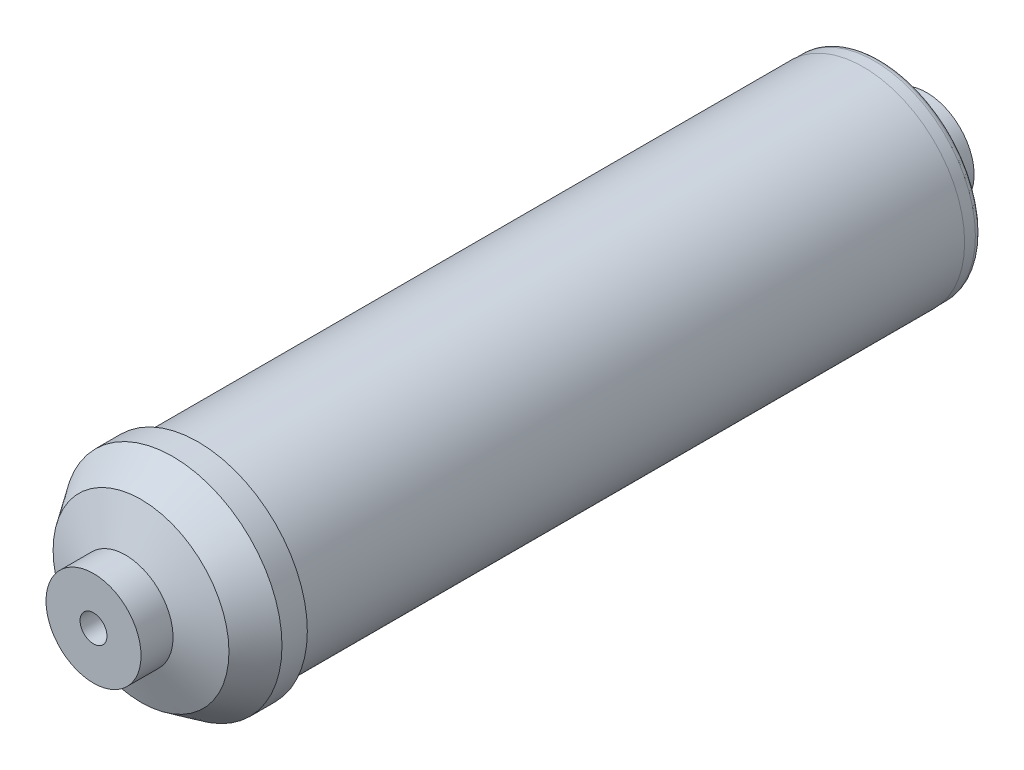
from build123d import *

# Parameters (mm, degrees)
SKETCH1_R           = 32
BOSS_EXTRUDE1_DEPTH = 210
SKETCH2_R           = 34.5
BOSS_EXTRUDE2_DEPTH = 18
CHAMFER1_SIZE       = 10
CHAMFER1_SIZE2      = 6.745085168
SKETCH3_R           = 27.754914832
BOSS_EXTRUDE3_DEPTH = 5
SKETCH4_R           = 15
BOSS_EXTRUDE4_DEPTH = 10
SKETCH5_R           = 4.25
CUT_EXTRUDE1_DEPTH  = 854
CHAMFER2_SIZE       = 5
CHAMFER2_SIZE_2     = 13.025445323
SKETCH7_R           = 31.9
BOSS_EXTRUDE7_DEPTH = 10
CHAMFER3_SIZE       = 5
CHAMFER3_SIZE2      = 17.437072219
FILLET1_R           = 2
BOSS_EXTRUDE8_START = 10
SKETCH8_R           = 15
BOSS_EXTRUDE8_DEPTH = 10
CUT_EXTRUDE2_START  = -311
SKETCH9_R           = 4.25
CUT_EXTRUDE2_DEPTH  = 311


with BuildPart() as part:
    # Sketch1 → Boss-Extrude1 (new body)
    with BuildSketch(Plane.XY):
        Circle(SKETCH1_R)
    extrude(amount=BOSS_EXTRUDE1_DEPTH)

    # Sketch2 → Boss-Extrude2 (add)
    with BuildSketch(Plane.XY.offset(210)):
        Circle(SKETCH2_R)
    extrude(amount=BOSS_EXTRUDE2_DEPTH)

    # Chamfer1
    chamfer1_edges = [part.edges().sort_by_distance(p)[0] for p in [
        (-34.5, 0, 228),
    ]]
    chamfer1_side = [part.faces().sort_by_distance(p)[0] for p in [
        (-34.5, 0, 219),
    ]]
    chamfer(chamfer1_edges, length=CHAMFER1_SIZE, length2=CHAMFER1_SIZE2, reference=chamfer1_side[0])

    # Sketch3 → Boss-Extrude3 (add)
    with BuildSketch(Plane.XY.offset(228)):
        Circle(SKETCH3_R)
    extrude(amount=BOSS_EXTRUDE3_DEPTH)

    # Sketch4 → Boss-Extrude4 (add)
    with BuildSketch(Plane.XY.offset(233)):
        Circle(SKETCH4_R)
    extrude(amount=BOSS_EXTRUDE4_DEPTH)

    # Sketch5 → Cut-Extrude1 (cut)
    with BuildSketch(Plane.XY.offset(243)):
        Circle(SKETCH5_R)
    extrude(amount=-CUT_EXTRUDE1_DEPTH, mode=Mode.SUBTRACT)

    # Chamfer2
    # the kernel refuses this chamfer: 13.025445323, 5 mm, written as the material it takes off along each edge
    with BuildSketch(Plane(origin=(0, 0, 233), x_dir=(1, 0, 0), z_dir=(0, -1, 0))) as chamfer2_piece_1_section:
        Polygon((27.754914832, -CHAMFER2_SIZE), (27.754914832 - CHAMFER2_SIZE_2, 0), (27.754914832, 0), align=None)
    chamfer2_piece_1 = revolve(axis=Axis((0, 0, 233), (0, 0, 1)), mode=Mode.PRIVATE)
    chamfer2_piece_1 = chamfer2_piece_1 - Plane(origin=(0, 0, 228.02141562), x_dir=(1, 0, 0), z_dir=(0, 0, -1)) * Cylinder(15, 112, mode=Mode.PRIVATE)
    add(chamfer2_piece_1, mode=Mode.SUBTRACT)

    # Sketch7 → Boss-Extrude7 (add)
    with BuildSketch(Plane(origin=(0, 0, 0), x_dir=(-1, 0, 0), z_dir=(0, 0, -1))):
        with Locations(Location((0, 0, 0), (0, 0, 180))):
            Circle(SKETCH7_R)
    extrude(amount=BOSS_EXTRUDE7_DEPTH)

    # Chamfer3
    chamfer3_edges = [part.edges().sort_by_distance(p)[0] for p in [
        (-31.9, 0, -10),
    ]]
    chamfer3_side = [part.faces().sort_by_distance(p)[0] for p in [
        (-31.9, 0, -5),
    ]]
    chamfer(chamfer3_edges, length=CHAMFER3_SIZE, length2=CHAMFER3_SIZE2, reference=chamfer3_side[0])

    # Fillet1
    fillet1_edges = [part.edges().sort_by_distance(p)[0] for p in [
        (-31.9, 0, -5),
    ]]
    fillet(fillet1_edges, radius=FILLET1_R)

    # Sketch8 → Boss-Extrude8 (add)
    with BuildSketch(Plane(origin=(0, 0, -10), x_dir=(-1, 0, 0), z_dir=(0, 0, -1)).offset(BOSS_EXTRUDE8_START)):
        Circle(SKETCH8_R)
    extrude(amount=-BOSS_EXTRUDE8_DEPTH)

    # Sketch9 → Cut-Extrude2 (cut)
    with BuildSketch(Plane(origin=(0, 0, -20), x_dir=(-1, 0, 0), z_dir=(0, 0, -1)).offset(CUT_EXTRUDE2_START)):
        with Locations(Location((0, 0, 0), (0, 0, 180))):
            Circle(SKETCH9_R)
    extrude(amount=CUT_EXTRUDE2_DEPTH, mode=Mode.SUBTRACT)


solid = part.part
